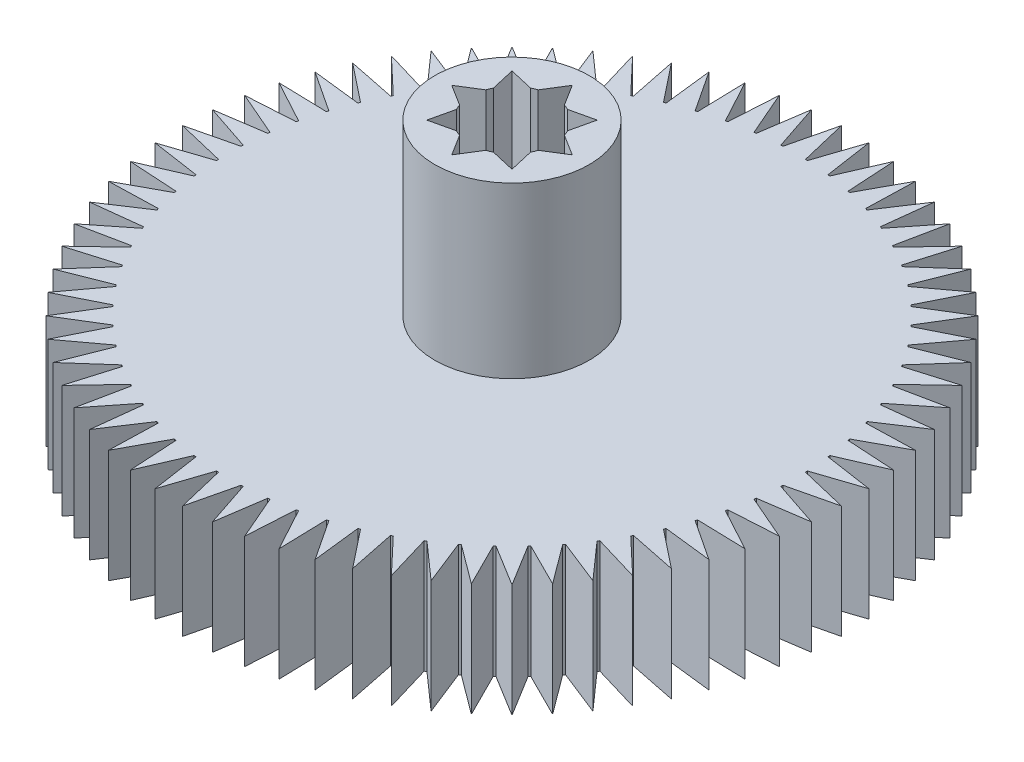
from build123d import *

# Parameters (mm, degrees)
EXTRUDE_5_DEPTH     = 6
EXTRUDE_6_DEPTH     = 6
SKETCH_4_R          = 4.1
EXTRUDE_10_DEPTH    = 9
CUT_EXTRUDE_1_DEPTH = 6
CUT_EXTRUDE_2_DEPTH = 4


with BuildPart() as part:
    # Эскиз1 → Бобышка-Вытянуть5 (new body)
    with BuildSketch(Plane(origin=(0, 0, 0), x_dir=(1, 0, 0), z_dir=(0, 1, 0))):
        with BuildLine():
            Line((0, 17.5), (-0.599879988, 14.988))
            ThreePointArc((-0.599879988, 14.988), (-0.65429081, 14.985723324), (-0.708693009, 14.983249121))
            Line((-0.708693009, 14.983249121), (-1.525225498, 17.433407217))
            Line((-1.525225498, 17.433407217), (-1.903887536, 14.878683149))
            ThreePointArc((-1.903887536, 14.878683149), (-1.957892883, 14.871672921), (-2.011872424, 14.864466669))
            Line((-2.011872424, 14.864466669), (-3.038843109, 17.234135678))
            Line((-3.038843109, 17.234135678), (-3.19340535, 14.656130535))
            ThreePointArc((-3.19340535, 14.656130535), (-3.246594209, 14.644440107), (-3.299740275, 14.63255665))
            Line((-3.299740275, 14.63255665), (-4.529333289, 16.90370196))
            Line((-4.529333289, 16.90370196), (-4.458619421, 14.322035919))
            ThreePointArc((-4.458619421, 14.322035919), (-4.510586993, 14.305754261), (-4.56249511, 14.28928404))
            Line((-4.56249511, 14.28928404), (-5.985352508, 16.444620864))
            Line((-5.985352508, 16.444620864), (-5.689900706, 13.878941961))
            ThreePointArc((-5.689900706, 13.878941961), (-5.740251485, 13.858192988), (-5.790526603, 13.83726135))
            Line((-5.790526603, 13.83726135), (-7.39581958, 15.860386273))
            Line((-7.39581958, 15.860386273), (-6.877878411, 13.330220874))
            ThreePointArc((-6.877878411, 13.330220874), (-6.926229199, 13.305162498), (-6.974488691, 13.279928746))
            Line((-6.974488691, 13.279928746), (-8.75, 15.155444566))
            Line((-8.75, 15.155444566), (-8.013511309, 12.680048758))
            ThreePointArc((-8.013511309, 12.680048758), (-8.059494125, 12.650871687), (-8.10537071, 12.621527866))
            Line((-8.10537071, 12.621527866), (-10.037587636, 14.335160775))
            Line((-10.037587636, 14.335160775), (-9.088156547, 11.933373814))
            ThreePointArc((-9.088156547, 11.933373814), (-9.131421435, 11.900300104), (-9.174565963, 11.867069537))
            Line((-9.174565963, 11.867069537), (-11.24878317, 13.405777755))
            Line((-11.24878317, 13.405777755), (-10.093635425, 11.09587869))
            ThreePointArc((-10.093635425, 11.09587869), (-10.133853114, 11.059160052), (-10.173937229, 11.022295644))
            Line((-10.173937229, 11.022295644), (-12.374368671, 12.374368671))
            Line((-12.374368671, 12.374368671), (-11.022295644, 10.173937229))
            ThreePointArc((-11.022295644, 10.173937229), (-11.059160052, 10.133853114), (-11.09587869, 10.093635425))
            Line((-11.09587869, 10.093635425), (-13.405777755, 11.24878317))
            Line((-13.405777755, 11.24878317), (-11.867069537, 9.174565963))
            ThreePointArc((-11.867069537, 9.174565963), (-11.900300104, 9.131421435), (-11.933373814, 9.088156547))
            Line((-11.933373814, 9.088156547), (-14.335160775, 10.037587636))
            Line((-14.335160775, 10.037587636), (-12.621527866, 8.10537071))
            ThreePointArc((-12.621527866, 8.10537071), (-12.650871687, 8.059494125), (-12.680048758, 8.013511309))
            Line((-12.680048758, 8.013511309), (-15.155444566, 8.75))
            Line((-15.155444566, 8.75), (-13.279928746, 6.974488691))
            ThreePointArc((-13.279928746, 6.974488691), (-13.305162498, 6.926229199), (-13.330220874, 6.877878411))
            Line((-13.330220874, 6.877878411), (-15.860386273, 7.39581958))
            Line((-15.860386273, 7.39581958), (-13.83726135, 5.790526603))
            ThreePointArc((-13.83726135, 5.790526603), (-13.858192988, 5.740251485), (-13.878941961, 5.689900706))
            Line((-13.878941961, 5.689900706), (-16.444620864, 5.985352508))
            Line((-16.444620864, 5.985352508), (-14.28928404, 4.56249511))
            ThreePointArc((-14.28928404, 4.56249511), (-14.305754261, 4.510586993), (-14.322035919, 4.458619421))
            Line((-14.322035919, 4.458619421), (-16.90370196, 4.529333289))
            Line((-16.90370196, 4.529333289), (-14.63255665, 3.299740275))
            ThreePointArc((-14.63255665, 3.299740275), (-14.644440107, 3.246594209), (-14.656130535, 3.19340535))
            Line((-14.656130535, 3.19340535), (-17.234135678, 3.038843109))
            Line((-17.234135678, 3.038843109), (-14.864466669, 2.011872424))
            ThreePointArc((-14.864466669, 2.011872424), (-14.871672921, 1.957892883), (-14.878683149, 1.903887536))
            Line((-14.878683149, 1.903887536), (-17.433407217, 1.525225498))
            Line((-17.433407217, 1.525225498), (-14.983249121, 0.708693009))
            ThreePointArc((-14.983249121, 0.708693009), (-14.985723324, 0.65429081), (-14.988, 0.599879988))
            Line((-14.988, 0.599879988), (-17.5, 0))
            Line((-17.5, 0), (-14.988, -0.599879988))
            ThreePointArc((-14.988, -0.599879988), (-14.985723324, -0.65429081), (-14.983249121, -0.708693009))
            Line((-14.983249121, -0.708693009), (-17.433407217, -1.525225498))
            Line((-17.433407217, -1.525225498), (-14.878683149, -1.903887536))
            ThreePointArc((-14.878683149, -1.903887536), (-14.871672921, -1.957892883), (-14.864466669, -2.011872424))
            Line((-14.864466669, -2.011872424), (-17.234135678, -3.038843109))
            Line((-17.234135678, -3.038843109), (-14.656130535, -3.19340535))
            ThreePointArc((-14.656130535, -3.19340535), (-14.644440107, -3.246594209), (-14.63255665, -3.299740275))
            Line((-14.63255665, -3.299740275), (-16.90370196, -4.529333289))
            Line((-16.90370196, -4.529333289), (-14.322035919, -4.458619421))
            ThreePointArc((-14.322035919, -4.458619421), (-14.305754261, -4.510586993), (-14.28928404, -4.56249511))
            Line((-14.28928404, -4.56249511), (-16.444620864, -5.985352508))
            Line((-16.444620864, -5.985352508), (-13.878941961, -5.689900706))
            ThreePointArc((-13.878941961, -5.689900706), (-13.858192988, -5.740251485), (-13.83726135, -5.790526603))
            Line((-13.83726135, -5.790526603), (-15.860386273, -7.39581958))
            Line((-15.860386273, -7.39581958), (-13.330220874, -6.877878411))
            ThreePointArc((-13.330220874, -6.877878411), (-13.305162498, -6.926229199), (-13.279928746, -6.974488691))
            Line((-13.279928746, -6.974488691), (-15.155444566, -8.75))
            Line((-15.155444566, -8.75), (-12.680048758, -8.013511309))
            ThreePointArc((-12.680048758, -8.013511309), (-12.650871687, -8.059494125), (-12.621527866, -8.10537071))
            Line((-12.621527866, -8.10537071), (-14.335160775, -10.037587636))
            Line((-14.335160775, -10.037587636), (-11.933373814, -9.088156547))
            ThreePointArc((-11.933373814, -9.088156547), (-11.900300104, -9.131421435), (-11.867069537, -9.174565963))
            Line((-11.867069537, -9.174565963), (-13.405777755, -11.24878317))
            Line((-13.405777755, -11.24878317), (-11.09587869, -10.093635425))
            ThreePointArc((-11.09587869, -10.093635425), (-11.059160052, -10.133853114), (-11.022295644, -10.173937229))
            Line((-11.022295644, -10.173937229), (-12.374368671, -12.374368671))
            Line((-12.374368671, -12.374368671), (-10.173937229, -11.022295644))
            ThreePointArc((-10.173937229, -11.022295644), (-10.133853114, -11.059160052), (-10.093635425, -11.09587869))
            Line((-10.093635425, -11.09587869), (-11.24878317, -13.405777755))
            Line((-11.24878317, -13.405777755), (-9.174565963, -11.867069537))
            ThreePointArc((-9.174565963, -11.867069537), (-9.131421435, -11.900300104), (-9.088156547, -11.933373814))
            Line((-9.088156547, -11.933373814), (-10.037587636, -14.335160775))
            Line((-10.037587636, -14.335160775), (-8.10537071, -12.621527866))
            ThreePointArc((-8.10537071, -12.621527866), (-8.059494125, -12.650871687), (-8.013511309, -12.680048758))
            Line((-8.013511309, -12.680048758), (-8.75, -15.155444566))
            Line((-8.75, -15.155444566), (-6.974488691, -13.279928746))
            ThreePointArc((-6.974488691, -13.279928746), (-6.926229199, -13.305162498), (-6.877878411, -13.330220874))
            Line((-6.877878411, -13.330220874), (-7.39581958, -15.860386273))
            Line((-7.39581958, -15.860386273), (-5.790526603, -13.83726135))
            ThreePointArc((-5.790526603, -13.83726135), (-5.740251485, -13.858192988), (-5.689900706, -13.878941961))
            Line((-5.689900706, -13.878941961), (-5.985352508, -16.444620864))
            Line((-5.985352508, -16.444620864), (-4.56249511, -14.28928404))
            ThreePointArc((-4.56249511, -14.28928404), (-4.510586993, -14.305754261), (-4.458619421, -14.322035919))
            Line((-4.458619421, -14.322035919), (-4.529333289, -16.90370196))
            Line((-4.529333289, -16.90370196), (-3.299740275, -14.63255665))
            ThreePointArc((-3.299740275, -14.63255665), (-3.246594209, -14.644440107), (-3.19340535, -14.656130535))
            Line((-3.19340535, -14.656130535), (-3.038843109, -17.234135678))
            Line((-3.038843109, -17.234135678), (-2.011872424, -14.864466669))
            ThreePointArc((-2.011872424, -14.864466669), (-1.957892883, -14.871672921), (-1.903887536, -14.878683149))
            Line((-1.903887536, -14.878683149), (-1.525225498, -17.433407217))
            Line((-1.525225498, -17.433407217), (-0.708693009, -14.983249121))
            ThreePointArc((-0.708693009, -14.983249121), (-0.65429081, -14.985723324), (-0.599879988, -14.988))
            Line((-0.599879988, -14.988), (0, -17.5))
            Line((0, -17.5), (0.599879988, -14.988))
            ThreePointArc((0.599879988, -14.988), (0.65429081, -14.985723324), (0.708693009, -14.983249121))
            Line((0.708693009, -14.983249121), (1.525225498, -17.433407217))
            Line((1.525225498, -17.433407217), (1.903887536, -14.878683149))
            ThreePointArc((1.903887536, -14.878683149), (1.957892883, -14.871672921), (2.011872424, -14.864466669))
            Line((2.011872424, -14.864466669), (3.038843109, -17.234135678))
            Line((3.038843109, -17.234135678), (3.19340535, -14.656130535))
            ThreePointArc((3.19340535, -14.656130535), (3.246594209, -14.644440107), (3.299740275, -14.63255665))
            Line((3.299740275, -14.63255665), (4.529333289, -16.90370196))
            Line((4.529333289, -16.90370196), (4.458619421, -14.322035919))
            ThreePointArc((4.458619421, -14.322035919), (4.510586993, -14.305754261), (4.56249511, -14.28928404))
            Line((4.56249511, -14.28928404), (5.985352508, -16.444620864))
            Line((5.985352508, -16.444620864), (5.689900706, -13.878941961))
            ThreePointArc((5.689900706, -13.878941961), (5.740251485, -13.858192988), (5.790526603, -13.83726135))
            Line((5.790526603, -13.83726135), (7.39581958, -15.860386273))
            Line((7.39581958, -15.860386273), (6.877878411, -13.330220874))
            ThreePointArc((6.877878411, -13.330220874), (6.926229199, -13.305162498), (6.974488691, -13.279928746))
            Line((6.974488691, -13.279928746), (8.75, -15.155444566))
            Line((8.75, -15.155444566), (8.013511309, -12.680048758))
            ThreePointArc((8.013511309, -12.680048758), (8.059494125, -12.650871687), (8.10537071, -12.621527866))
            Line((8.10537071, -12.621527866), (10.037587636, -14.335160775))
            Line((10.037587636, -14.335160775), (9.088156547, -11.933373814))
            ThreePointArc((9.088156547, -11.933373814), (9.131421435, -11.900300104), (9.174565963, -11.867069537))
            Line((9.174565963, -11.867069537), (11.24878317, -13.405777755))
            Line((11.24878317, -13.405777755), (10.093635425, -11.09587869))
            ThreePointArc((10.093635425, -11.09587869), (10.133853114, -11.059160052), (10.173937229, -11.022295644))
            Line((10.173937229, -11.022295644), (12.374368671, -12.374368671))
            Line((12.374368671, -12.374368671), (11.022295644, -10.173937229))
            ThreePointArc((11.022295644, -10.173937229), (11.059160052, -10.133853114), (11.09587869, -10.093635425))
            Line((11.09587869, -10.093635425), (13.405777755, -11.24878317))
            Line((13.405777755, -11.24878317), (11.867069537, -9.174565963))
            ThreePointArc((11.867069537, -9.174565963), (11.900300104, -9.131421435), (11.933373814, -9.088156547))
            Line((11.933373814, -9.088156547), (14.335160775, -10.037587636))
            Line((14.335160775, -10.037587636), (12.621527866, -8.10537071))
            ThreePointArc((12.621527866, -8.10537071), (12.650871687, -8.059494125), (12.680048758, -8.013511309))
            Line((12.680048758, -8.013511309), (15.155444566, -8.75))
            Line((15.155444566, -8.75), (13.279928746, -6.974488691))
            ThreePointArc((13.279928746, -6.974488691), (13.305162498, -6.926229199), (13.330220874, -6.877878411))
            Line((13.330220874, -6.877878411), (15.860386273, -7.39581958))
            Line((15.860386273, -7.39581958), (13.83726135, -5.790526603))
            ThreePointArc((13.83726135, -5.790526603), (13.858192988, -5.740251485), (13.878941961, -5.689900706))
            Line((13.878941961, -5.689900706), (16.444620864, -5.985352508))
            Line((16.444620864, -5.985352508), (14.28928404, -4.56249511))
            ThreePointArc((14.28928404, -4.56249511), (14.305754261, -4.510586993), (14.322035919, -4.458619421))
            Line((14.322035919, -4.458619421), (16.90370196, -4.529333289))
            Line((16.90370196, -4.529333289), (14.63255665, -3.299740275))
            ThreePointArc((14.63255665, -3.299740275), (14.644440107, -3.246594209), (14.656130535, -3.19340535))
            Line((14.656130535, -3.19340535), (17.234135678, -3.038843109))
            Line((17.234135678, -3.038843109), (14.864466669, -2.011872424))
            ThreePointArc((14.864466669, -2.011872424), (14.871672921, -1.957892883), (14.878683149, -1.903887536))
            Line((14.878683149, -1.903887536), (17.433407217, -1.525225498))
            Line((17.433407217, -1.525225498), (14.983249121, -0.708693009))
            ThreePointArc((14.983249121, -0.708693009), (14.985723324, -0.65429081), (14.988, -0.599879988))
            Line((14.988, -0.599879988), (17.5, 0))
            Line((17.5, 0), (14.988, 0.599879988))
            ThreePointArc((14.988, 0.599879988), (14.985723324, 0.65429081), (14.983249121, 0.708693009))
            Line((14.983249121, 0.708693009), (17.433407217, 1.525225498))
            Line((17.433407217, 1.525225498), (14.878683149, 1.903887536))
            ThreePointArc((14.878683149, 1.903887536), (14.871672921, 1.957892883), (14.864466669, 2.011872424))
            Line((14.864466669, 2.011872424), (17.234135678, 3.038843109))
            Line((17.234135678, 3.038843109), (14.656130535, 3.19340535))
            ThreePointArc((14.656130535, 3.19340535), (14.644440107, 3.246594209), (14.63255665, 3.299740275))
            Line((14.63255665, 3.299740275), (16.90370196, 4.529333289))
            Line((16.90370196, 4.529333289), (14.322035919, 4.458619421))
            ThreePointArc((14.322035919, 4.458619421), (14.305754261, 4.510586993), (14.28928404, 4.56249511))
            Line((14.28928404, 4.56249511), (16.444620864, 5.985352508))
            Line((16.444620864, 5.985352508), (13.878941961, 5.689900706))
            ThreePointArc((13.878941961, 5.689900706), (13.858192988, 5.740251485), (13.83726135, 5.790526603))
            Line((13.83726135, 5.790526603), (15.860386273, 7.39581958))
            Line((15.860386273, 7.39581958), (13.330220874, 6.877878411))
            ThreePointArc((13.330220874, 6.877878411), (13.305162498, 6.926229199), (13.279928746, 6.974488691))
            Line((13.279928746, 6.974488691), (15.155444566, 8.75))
            Line((15.155444566, 8.75), (12.680048758, 8.013511309))
            ThreePointArc((12.680048758, 8.013511309), (12.650871687, 8.059494125), (12.621527866, 8.10537071))
            Line((12.621527866, 8.10537071), (14.335160775, 10.037587636))
            Line((14.335160775, 10.037587636), (11.933373814, 9.088156547))
            ThreePointArc((11.933373814, 9.088156547), (11.900300104, 9.131421435), (11.867069537, 9.174565963))
            Line((11.867069537, 9.174565963), (13.405777755, 11.24878317))
            Line((13.405777755, 11.24878317), (11.09587869, 10.093635425))
            ThreePointArc((11.09587869, 10.093635425), (11.059160052, 10.133853114), (11.022295644, 10.173937229))
            Line((11.022295644, 10.173937229), (12.374368671, 12.374368671))
            Line((12.374368671, 12.374368671), (10.173937229, 11.022295644))
            ThreePointArc((10.173937229, 11.022295644), (10.133853114, 11.059160052), (10.093635425, 11.09587869))
            Line((10.093635425, 11.09587869), (11.24878317, 13.405777755))
            Line((11.24878317, 13.405777755), (9.174565963, 11.867069537))
            ThreePointArc((9.174565963, 11.867069537), (9.131421435, 11.900300104), (9.088156547, 11.933373814))
            Line((9.088156547, 11.933373814), (10.037587636, 14.335160775))
            Line((10.037587636, 14.335160775), (8.10537071, 12.621527866))
            ThreePointArc((8.10537071, 12.621527866), (8.059494125, 12.650871687), (8.013511309, 12.680048758))
            Line((8.013511309, 12.680048758), (8.75, 15.155444566))
            Line((8.75, 15.155444566), (6.974488691, 13.279928746))
            ThreePointArc((6.974488691, 13.279928746), (6.926229199, 13.305162498), (6.877878411, 13.330220874))
            Line((6.877878411, 13.330220874), (7.39581958, 15.860386273))
            Line((7.39581958, 15.860386273), (5.790526603, 13.83726135))
            ThreePointArc((5.790526603, 13.83726135), (5.740251485, 13.858192988), (5.689900706, 13.878941961))
            Line((5.689900706, 13.878941961), (5.985352508, 16.444620864))
            Line((5.985352508, 16.444620864), (4.56249511, 14.28928404))
            ThreePointArc((4.56249511, 14.28928404), (4.510586993, 14.305754261), (4.458619421, 14.322035919))
            Line((4.458619421, 14.322035919), (4.529333289, 16.90370196))
            Line((4.529333289, 16.90370196), (3.299740275, 14.63255665))
            ThreePointArc((3.299740275, 14.63255665), (3.246594209, 14.644440107), (3.19340535, 14.656130535))
            Line((3.19340535, 14.656130535), (3.038843109, 17.234135678))
            Line((3.038843109, 17.234135678), (2.011872424, 14.864466669))
            ThreePointArc((2.011872424, 14.864466669), (1.957892883, 14.871672921), (1.903887536, 14.878683149))
            Line((1.903887536, 14.878683149), (1.525225498, 17.433407217))
            Line((1.525225498, 17.433407217), (0.708693009, 14.983249121))
            ThreePointArc((0.708693009, 14.983249121), (0.65429081, 14.985723324), (0.599879988, 14.988))
            Line((0.599879988, 14.988), (0, 17.5))
        make_face()
        with BuildLine():
            ThreePointArc((2.2, 1.5), (2.517970617, 0), (2.2, -1.5))
            Line((2.2, -1.5), (-2.2, -1.5))
            ThreePointArc((-2.2, -1.5), (-2.493941045, 0), (-2.2, 1.5))
            Line((-2.2, 1.5), (2.2, 1.5))
        make_face(mode=Mode.SUBTRACT)
    extrude(amount=EXTRUDE_5_DEPTH)

    # Эскиз1<5> → Бобышка-Вытянуть6 (add)
    with BuildSketch(Plane(origin=(0, 0, 0), x_dir=(1, 0, 0), z_dir=(0, 1, 0))):
        with BuildLine():
            Line((0, 1.5), (2.2, 1.5))
            ThreePointArc((2.2, 1.5), (2.517970617, 0), (2.2, -1.5))
            Line((2.2, -1.5), (0, -1.5))
            Line((0, -1.5), (-2.2, -1.5))
            ThreePointArc((-2.2, -1.5), (-2.493941045, 0), (-2.2, 1.5))
            Line((-2.2, 1.5), (0, 1.5))
        make_face()
    extrude(amount=EXTRUDE_6_DEPTH)

    # Эскиз4 → Бобышка-Вытянуть10 (add)
    with BuildSketch(Plane(origin=(0, 6, 0), x_dir=(1, 0, 0), z_dir=(0, 1, 0))):
        Circle(SKETCH_4_R)
    extrude(amount=EXTRUDE_10_DEPTH)

    # Эскиз7 → Вырез-Вытянуть1 (cut)
    with BuildSketch(Plane(origin=(0, 15, 0), x_dir=(1, 0, 0), z_dir=(0, 1, 0))):
        with BuildLine():
            Line((0, 3.2), (-0.694930378, 2.08736))
            ThreePointArc((-0.694930378, 2.08736), (-0.841903551, 2.032534972), (-0.984596428, 1.967376394))
            Line((-0.984596428, 1.967376394), (-2.2627417, 2.2627417))
            Line((-2.2627417, 2.2627417), (-1.967376394, 0.984596428))
            ThreePointArc((-1.967376394, 0.984596428), (-2.032534972, 0.841903551), (-2.08736, 0.694930378))
            Line((-2.08736, 0.694930378), (-3.2, 0))
            Line((-3.2, 0), (-2.08736, -0.694930378))
            ThreePointArc((-2.08736, -0.694930378), (-2.032534972, -0.841903551), (-1.967376394, -0.984596428))
            Line((-1.967376394, -0.984596428), (-2.2627417, -2.2627417))
            Line((-2.2627417, -2.2627417), (-0.984596428, -1.967376394))
            ThreePointArc((-0.984596428, -1.967376394), (-0.841903551, -2.032534972), (-0.694930378, -2.08736))
            Line((-0.694930378, -2.08736), (0, -3.2))
            Line((0, -3.2), (0.694930378, -2.08736))
            ThreePointArc((0.694930378, -2.08736), (0.841903551, -2.032534972), (0.984596428, -1.967376394))
            Line((0.984596428, -1.967376394), (2.2627417, -2.2627417))
            Line((2.2627417, -2.2627417), (1.967376394, -0.984596428))
            ThreePointArc((1.967376394, -0.984596428), (2.032534972, -0.841903551), (2.08736, -0.694930378))
            Line((2.08736, -0.694930378), (3.2, 0))
            Line((3.2, 0), (2.08736, 0.694930378))
            ThreePointArc((2.08736, 0.694930378), (2.032534972, 0.841903551), (1.967376394, 0.984596428))
            Line((1.967376394, 0.984596428), (2.2627417, 2.2627417))
            Line((2.2627417, 2.2627417), (0.984596428, 1.967376394))
            ThreePointArc((0.984596428, 1.967376394), (0.841903551, 2.032534972), (0.694930378, 2.08736))
            Line((0.694930378, 2.08736), (0, 3.2))
        make_face()
    extrude(amount=-CUT_EXTRUDE_1_DEPTH, mode=Mode.SUBTRACT)

    # Эскиз9 → Вырез-Вытянуть2 (cut)
    with BuildSketch(Plane(origin=(0, 0, 0), x_dir=(-1, 0, 0), z_dir=(0, -1, 0))):
        with BuildLine():
            Line((3.031088913, 1.75), (1.50196048, 1.998528137))
            ThreePointArc((1.50196048, 1.998528137), (1.25, 2.165063509), (0.979795897, 2.3))
            Line((0.979795897, 2.3), (0, 3.5))
            Line((0, 3.5), (-0.979795897, 2.3))
            ThreePointArc((-0.979795897, 2.3), (-1.25, 2.165063509), (-1.50196048, 1.998528137))
            Line((-1.50196048, 1.998528137), (-3.031088913, 1.75))
            Line((-3.031088913, 1.75), (-2.481756377, 0.301471863))
            ThreePointArc((-2.481756377, 0.301471863), (-2.5, 0), (-2.481756377, -0.301471863))
            Line((-2.481756377, -0.301471863), (-3.031088913, -1.75))
            Line((-3.031088913, -1.75), (-1.50196048, -1.998528137))
            ThreePointArc((-1.50196048, -1.998528137), (-1.25, -2.165063509), (-0.979795897, -2.3))
            Line((-0.979795897, -2.3), (0, -3.5))
            Line((0, -3.5), (0.979795897, -2.3))
            ThreePointArc((0.979795897, -2.3), (1.25, -2.165063509), (1.50196048, -1.998528137))
            Line((1.50196048, -1.998528137), (3.031088913, -1.75))
            Line((3.031088913, -1.75), (2.481756377, -0.301471863))
            ThreePointArc((2.481756377, -0.301471863), (2.5, 0), (2.481756377, 0.301471863))
            Line((2.481756377, 0.301471863), (3.031088913, 1.75))
        make_face()
    extrude(amount=-CUT_EXTRUDE_2_DEPTH, mode=Mode.SUBTRACT)


solid = part.part
